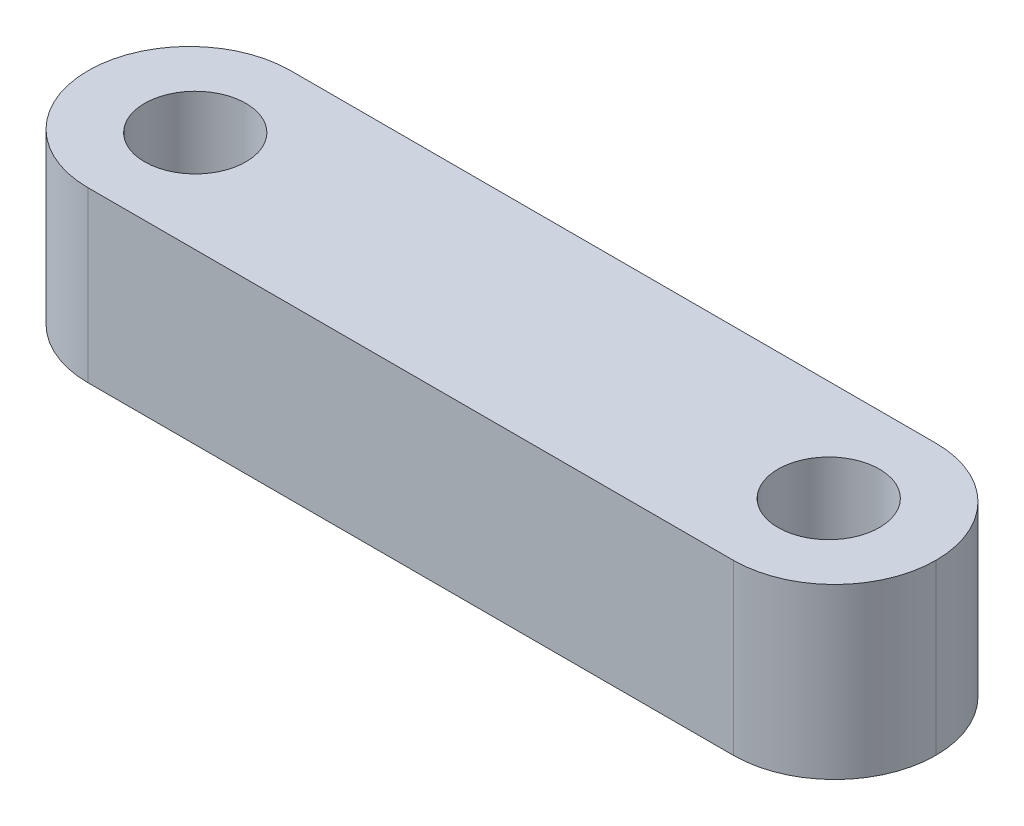
from build123d import *

# Parameters (mm, degrees)
SKETCH1_W           = 50.2
SKETCH1_H           = 12
SKETCH1_R           = 3
BOSS_EXTRUDE1_DEPTH = 10
FILLET1_R           = 6


with BuildPart() as part:
    # Sketch1 → Boss-Extrude1 (new body)
    with BuildSketch(Plane(origin=(0, 0, 0), x_dir=(1, 0, 0), z_dir=(0, 1, 0))):
        Rectangle(SKETCH1_W, SKETCH1_H)
        with Locations(Location((18.75, 0, 0), (0, 0, 270))):
            Circle(SKETCH1_R, mode=Mode.SUBTRACT)
        with Locations(Location((-18.75, 0, 0), (0, 0, 270))):
            Circle(SKETCH1_R, mode=Mode.SUBTRACT)
    extrude(amount=BOSS_EXTRUDE1_DEPTH)

    # Fillet1
    fillet1_edges = [part.edges().sort_by_distance(p)[0] for p in [
        (25.1, 5, -6),
        (25.1, 5, 6),
        (-25.1, 5, -6),
        (-25.1, 5, 6),
    ]]
    fillet(fillet1_edges, radius=FILLET1_R - 0.0001)  # a hair under: the kernel refuses the full size


solid = part.part
